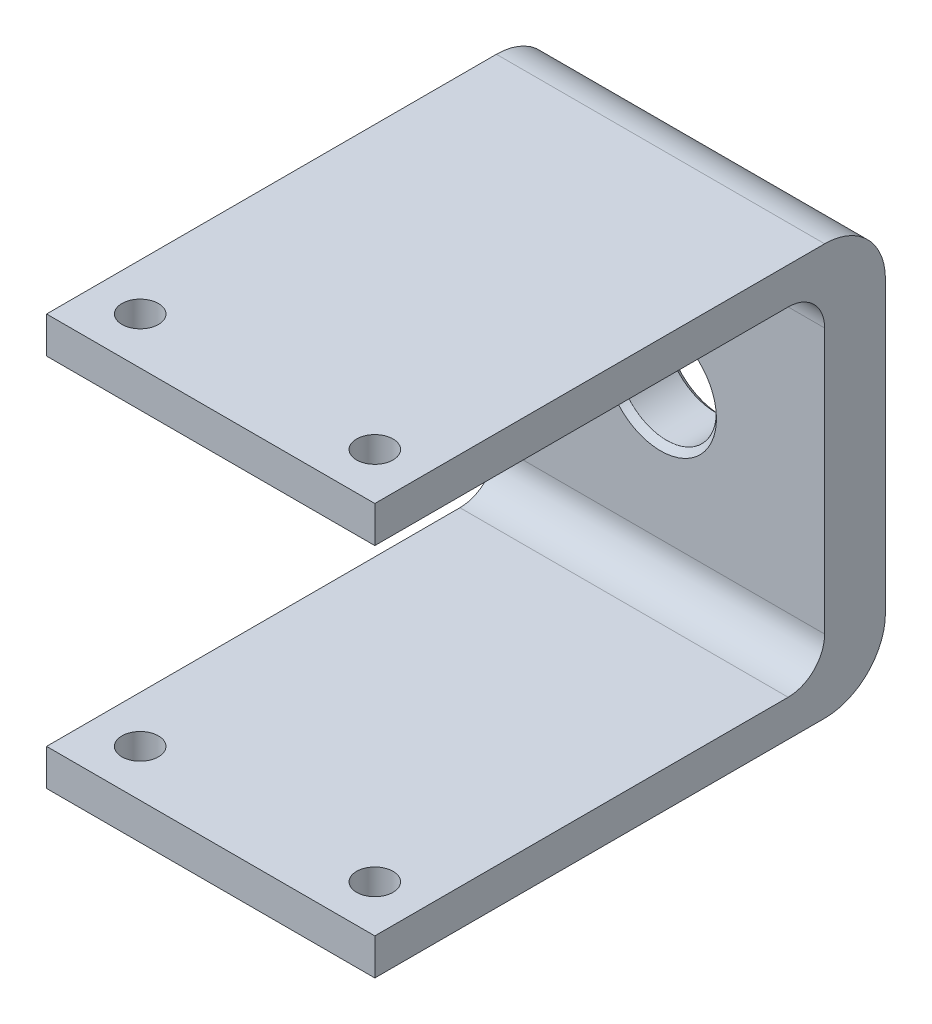
from build123d import *

# Parameters (mm, degrees)
SKETCH1_W           = 27
SKETCH1_H           = 42
SKETCH1_R           = 1.5
BOSS_EXTRUDE1_DEPTH = 3
SKETCH1_3_W         = 27
SKETCH1_3_H         = 5
BOSS_EXTRUDE2_DEPTH = 13.9
FILLET1_R           = 3
FILLET2_R           = 5
SKETCH3_R           = 4.1
CUT_EXTRUDE1_DEPTH  = 13.9
FILLET3_SIZE        = 0.5


with BuildPart() as part:
    # Sketch1 → Boss-Extrude1 (new body)
    with BuildSketch(Plane(origin=(0, 0, 0), x_dir=(1, 0, 0), z_dir=(0, 1, 0))):
        with Locations((39.822610006, -138.150649163)):
            Rectangle(SKETCH1_W, SKETCH1_H)
        with Locations(Location((49.472610006, -155.300649163, 0), (0, 0, 270))):
            Circle(SKETCH1_R, mode=Mode.SUBTRACT)
        with Locations(Location((30.172610006, -155.300649163, 0), (0, 0, 270))):
            Circle(SKETCH1_R, mode=Mode.SUBTRACT)
    extrude(amount=BOSS_EXTRUDE1_DEPTH)

    # Sketch1<3> → Boss-Extrude2 (add)
    with BuildSketch(Plane(origin=(0, 0, 0), x_dir=(1, 0, 0), z_dir=(0, 1, 0))):
        with Locations((39.822610006, -119.650649163)):
            Rectangle(SKETCH1_3_W, SKETCH1_3_H)
    extrude(amount=-BOSS_EXTRUDE2_DEPTH)

    # Fillet1
    fillet1_edges = [part.edges().sort_by_distance(p)[0] for p in [
        (39.822610006, 0, 122.150649163),
    ]]
    fillet(fillet1_edges, radius=FILLET1_R)

    # Fillet2
    fillet2_edges = [part.edges().sort_by_distance(p)[0] for p in [
        (39.822610006, 3, 117.150649163),
    ]]
    fillet(fillet2_edges, radius=FILLET2_R)

    # Mirror7: part across plane


with BuildPart() as part_1:
    add(part.part)
    add(part.part.mirror(Plane.ZX.offset(-13.9)))

    # Sketch3 → Cut-Extrude1 (cut)
    with BuildSketch(Plane(origin=(0, 0, 117.150649163), x_dir=(-1, 0, 0), z_dir=(0, 0, -1))):
        with Locations((-39.822610006, -13.9)):
            Circle(SKETCH3_R)
    extrude(amount=-CUT_EXTRUDE1_DEPTH, mode=Mode.SUBTRACT)

    # Fillet3
    # a fillet whose section is not a circle: 0.5 mm, written as the material it takes off along each edge
    with BuildSketch(Plane(origin=(39.822610006, -13.9, 122.150649163), x_dir=(-1, 0, 0), z_dir=(0, -1, 0))) as fillet3_piece_1:
        with BuildLine():
            Bezier((4.1 + FILLET3_SIZE, 0), (4.1, 0), (4.1, FILLET3_SIZE), weights=[1, 0.035355339, 1])
            Line((4.1, FILLET3_SIZE), (4.1, 0))
            Line((4.1, 0), (4.1 + FILLET3_SIZE, 0))
        make_face()
    revolve(axis=Axis((39.822610006, -13.9, 122.150649163), (0, 0, -1)), mode=Mode.SUBTRACT)
    with BuildSketch(Plane(origin=(39.822610006, -13.9, 117.150649163), x_dir=(-1, 0, 0), z_dir=(0, -1, 0))) as fillet3_piece_2:
        with BuildLine():
            Bezier((4.1 + FILLET3_SIZE, 0), (4.1, 0), (4.1, -FILLET3_SIZE), weights=[1, 0.035355339, 1])
            Line((4.1, -FILLET3_SIZE), (4.1, 0))
            Line((4.1, 0), (4.1 + FILLET3_SIZE, 0))
        make_face()
    revolve(axis=Axis((39.822610006, -13.9, 117.150649163), (0, 0, -1)), mode=Mode.SUBTRACT)


solid = part_1.part
